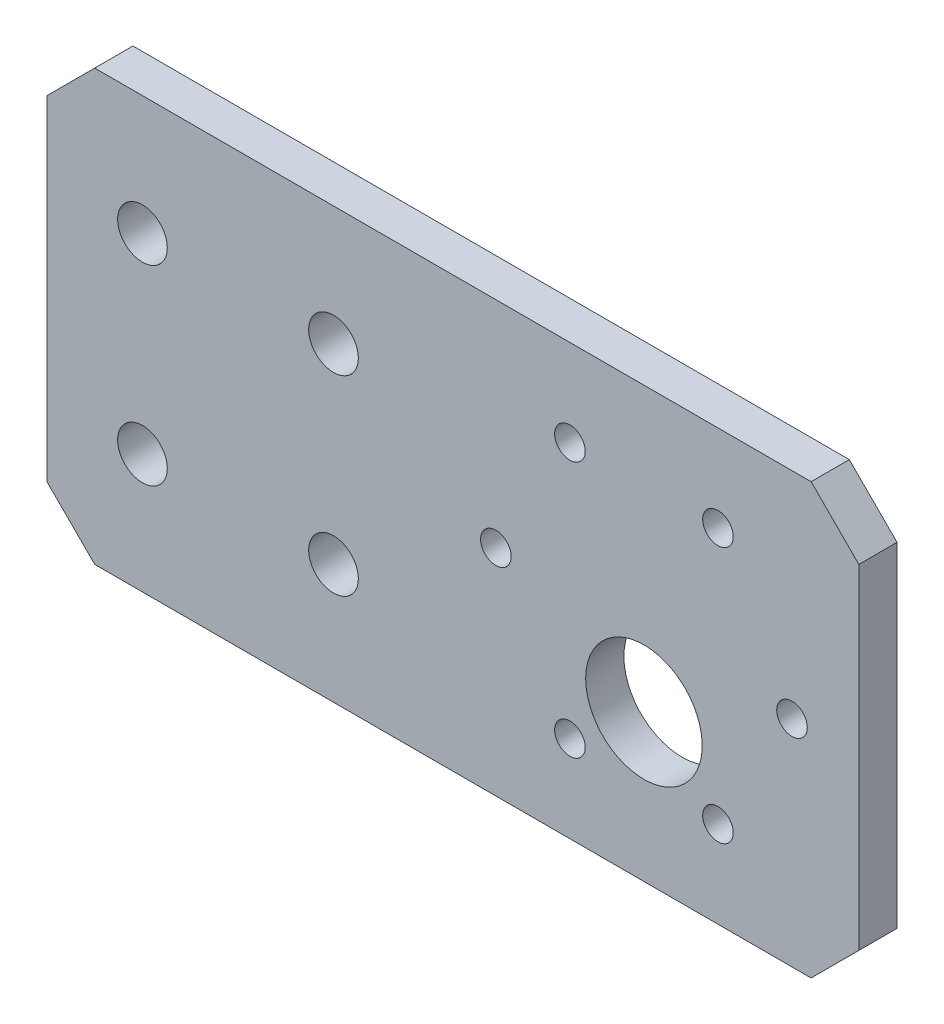
from build123d import *

# Parameters (mm, degrees)
SKETCH1_W                   = 85
SKETCH1_H                   = 45
BOSS_EXTRUDE1_DEPTH         = 4
SKETCH3_R                   = 2.6
CUT_EXTRUDE2_DEPTH          = 49.254533466
CHAMFER1_SIZE               = 5
SKETCH2_R                   = 1.6
CUT_EXTRUDE_1_DEPTH         = 49.254533466
PATTERN_LINEAR_1_COUNT      = 2
PATTERN_LINEAR_1_PITCH      = 20
PATTERN_LINEAR_1_COUNT_DIR2 = 2
PATTERN_LINEAR_1_PITCH_DIR2 = 20
SKETCH_1_R                  = 6.1
CUT_EXTRUDE_2_DEPTH         = 49.254533466


with BuildPart() as part:
    # Sketch1 → Boss-Extrude1 (new body)
    with BuildSketch(Plane.XY):
        Rectangle(SKETCH1_W, SKETCH1_H)
    extrude(amount=BOSS_EXTRUDE1_DEPTH)

    # Sketch3 → Cut-Extrude2 (cut, through all)
    with BuildSketch(Plane.XY.offset(4)):
        with Locations((-32.5, -10)):
            Circle(SKETCH3_R)
    cut_extrude2 = extrude(amount=-CUT_EXTRUDE2_DEPTH, mode=Mode.SUBTRACT)

    # Chamfer1
    chamfer1_edges = [part.edges().sort_by_distance(p)[0] for p in [
        (42.5, 22.5, 2),
        (42.5, -22.5, 2),
        (-42.5, -22.5, 2),
        (-42.5, 22.5, 2),
    ]]
    chamfer(chamfer1_edges, length=CHAMFER1_SIZE)

    # Sketch2 → 除料-伸長1 (cut, through all)
    with BuildSketch(Plane.XY.offset(4)):
        with Locations((35.5, 0)):
            Circle(SKETCH2_R)
        with Locations((27.75, -13.423393759)):
            Circle(SKETCH2_R)
        with Locations((12.25, -13.423393759)):
            Circle(SKETCH2_R)
        with Locations((4.5, 0)):
            Circle(SKETCH2_R)
        with Locations((12.25, 13.423393759)):
            Circle(SKETCH2_R)
        with Locations((27.75, 13.423393759)):
            Circle(SKETCH2_R)
    extrude(amount=-CUT_EXTRUDE_1_DEPTH, mode=Mode.SUBTRACT)

    # 直線複製排列1: Cut-Extrude2 2 × 2
    with Locations(*[(j * PATTERN_LINEAR_1_PITCH_DIR2, i * PATTERN_LINEAR_1_PITCH, 0) for i in range(PATTERN_LINEAR_1_COUNT) for j in range(PATTERN_LINEAR_1_COUNT_DIR2) if (i, j) != (0, 0)]):
        add(cut_extrude2, mode=Mode.SUBTRACT)

    # 草圖1 → 除料-伸長2 (cut, through all)
    with BuildSketch(Plane(origin=(0, 0, 0), x_dir=(-1, 0, 0), z_dir=(0, 0, -1))):
        with Locations((-20, -7.14)):
            Circle(SKETCH_1_R)
    extrude(amount=-CUT_EXTRUDE_2_DEPTH, mode=Mode.SUBTRACT)


solid = part.part
